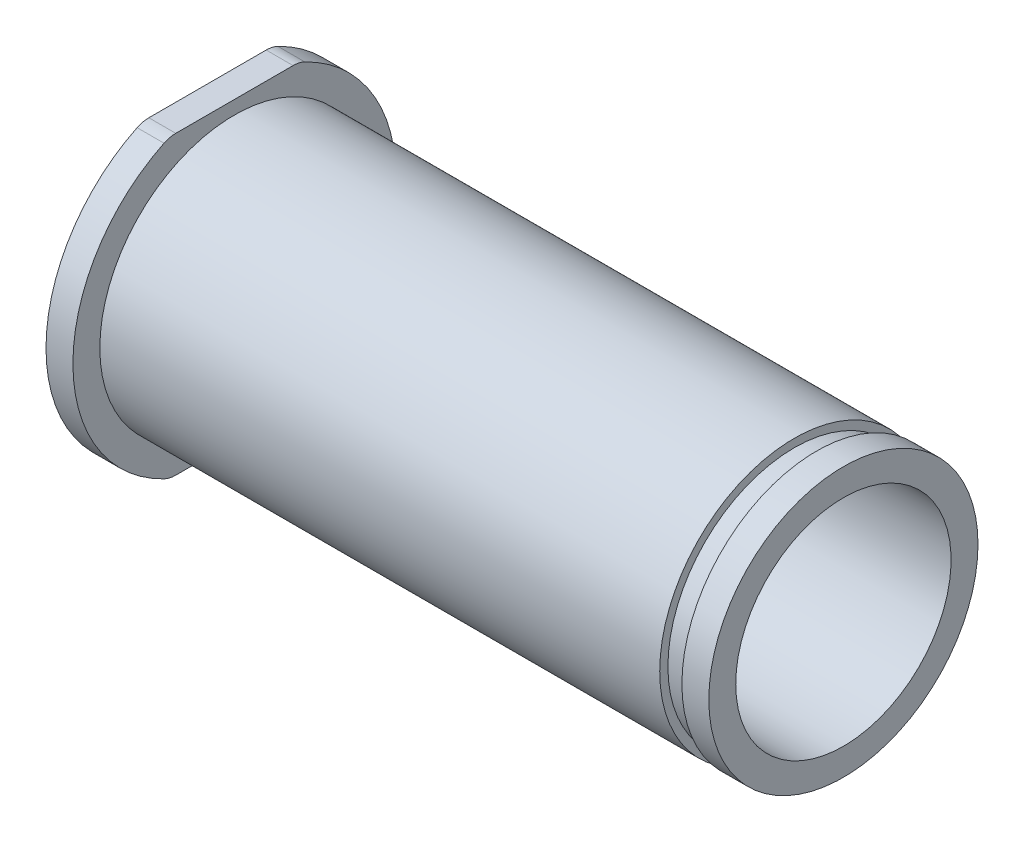
from build123d import *

# Parameters (mm, degrees)
SKETCH2_W          = 15.226765086
SKETCH2_H          = 1.5875
CUT_EXTRUDE1_DEPTH = 80.697773108
FILLET1_R          = 3.175


with BuildPart() as part:
    # Sketch1 → Revolve1 (revolve)
    with BuildSketch(Plane.XY):
        Polygon((0, 19.05), (0, 12.7), (75.0062, 12.7), (75.0062, 15.875), (71.8312, 15.875), (71.8312, 14.9098), (69.215, 14.9098), (69.215, 15.875), (3.175, 15.875), (3.175, 19.05), align=None)
    revolve(axis=Axis((0, 0, 0), (1, 0, 0)))

    # Sketch2 → Cut-Extrude1 (cut, through all)
    with BuildSketch(Plane.ZY):
        with Locations((0, 18.25625)):
            Rectangle(SKETCH2_W, SKETCH2_H)
        with Locations((0, -18.25625)):
            Rectangle(SKETCH2_W, SKETCH2_H)
    extrude(amount=-CUT_EXTRUDE1_DEPTH, mode=Mode.SUBTRACT)

    # Fillet1
    fillet1_edges = [part.edges().sort_by_distance(p)[0] for p in [
        (1.5875, -17.4625, -7.613382543),
        (1.5875, -17.4625, 7.613382543),
        (1.5875, 17.4625, 7.613382543),
        (1.5875, 17.4625, -7.613382543),
    ]]
    fillet(fillet1_edges, radius=FILLET1_R)


solid = part.part
